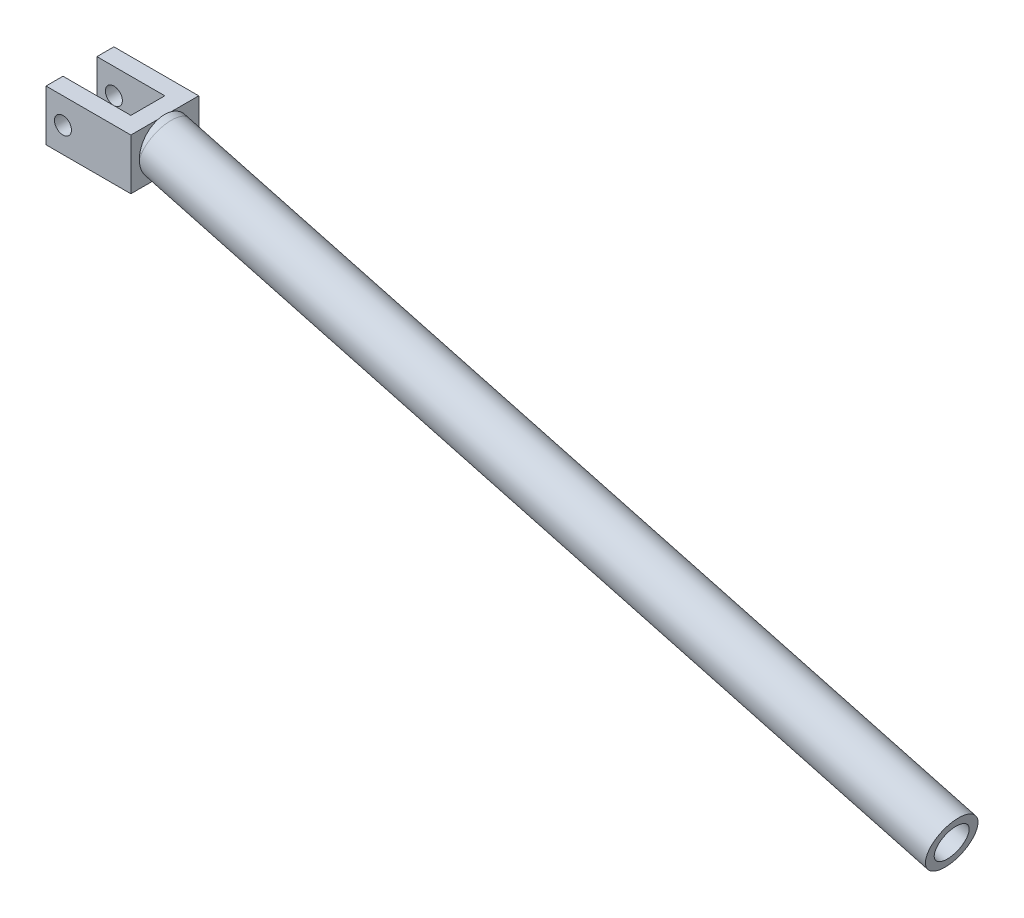
from build123d import *

# Parameters (mm, degrees)
SWEEP1_START         = -25.4
SWEEP1_OUTLINE_R     = 19.05
SWEEP1_DEPTH         = 635
CUT_SWEEP1_START     = -25.4
CUT_SWEEP1_OUTLINE_R = 12.7
CUT_SWEEP1_DEPTH     = 635
SKETCH25_R           = 57.15
CUT_EXTRUDE1_DEPTH   = 620.637672354
SKETCH26_W           = 50.8
SKETCH26_H           = 38.1
BOSS_EXTRUDE1_DEPTH  = 12.7
SKETCH27_W           = 12.7
SKETCH27_H           = 38.1
BOSS_EXTRUDE2_DEPTH  = 50.8
SKETCH28_R           = 6.35
CUT_EXTRUDE2_DEPTH   = 622.424639437


# Read off the part's stored shape, not the designer's step: Sweep1, Cut-Sweep1
with BuildPart() as part:
    # Sweep1 outline → Sweep1 (new body)
    with BuildSketch(Plane(origin=(0, 0, 0), x_dir=(0.2588190451025211, 0.9659258262890682, 0), z_dir=(0.9659258262890682, -0.2588190451025211, 0)).offset(SWEEP1_START)):
        Circle(SWEEP1_OUTLINE_R)
    extrude(amount=SWEEP1_DEPTH)

    # Cut-Sweep1 outline → Cut-Sweep1 (cut)
    with BuildSketch(Plane(origin=(0, 0, 0), x_dir=(0.2588190451025211, 0.9659258262890682, 0), z_dir=(0.9659258262890682, -0.2588190451025211, 0)).offset(CUT_SWEEP1_START)):
        Circle(CUT_SWEEP1_OUTLINE_R)
    extrude(amount=CUT_SWEEP1_DEPTH, mode=Mode.SUBTRACT)

    # Sketch25 → Cut-Extrude1 (cut, through all)
    with BuildSketch(Plane(origin=(0, 0, 0), x_dir=(0, 0, -1), z_dir=(1, 0, 0))):
        Circle(SKETCH25_R)
    extrude(amount=-CUT_EXTRUDE1_DEPTH, mode=Mode.SUBTRACT)

    # Sketch26 → Boss-Extrude1 (add)
    with BuildSketch(Plane(origin=(0, 0, 0), x_dir=(0, 0, -1), z_dir=(1, 0, 0))):
        Rectangle(SKETCH26_W, SKETCH26_H)
    extrude(amount=-BOSS_EXTRUDE1_DEPTH)

    # Sketch27 → Boss-Extrude2 (add)
    with BuildSketch(Plane.ZY.offset(12.7)):
        with Locations((19.05, 0)):
            Rectangle(SKETCH27_W, SKETCH27_H)
        with Locations((-19.05, 0)):
            Rectangle(SKETCH27_W, SKETCH27_H)
    extrude(amount=BOSS_EXTRUDE2_DEPTH)

    # Sketch28 → Cut-Extrude2 (cut, through all)
    with BuildSketch(Plane.XY.offset(25.4)):
        with Locations((-50.8, 0)):
            Circle(SKETCH28_R)
    extrude(amount=-CUT_EXTRUDE2_DEPTH, mode=Mode.SUBTRACT)


solid = part.part
